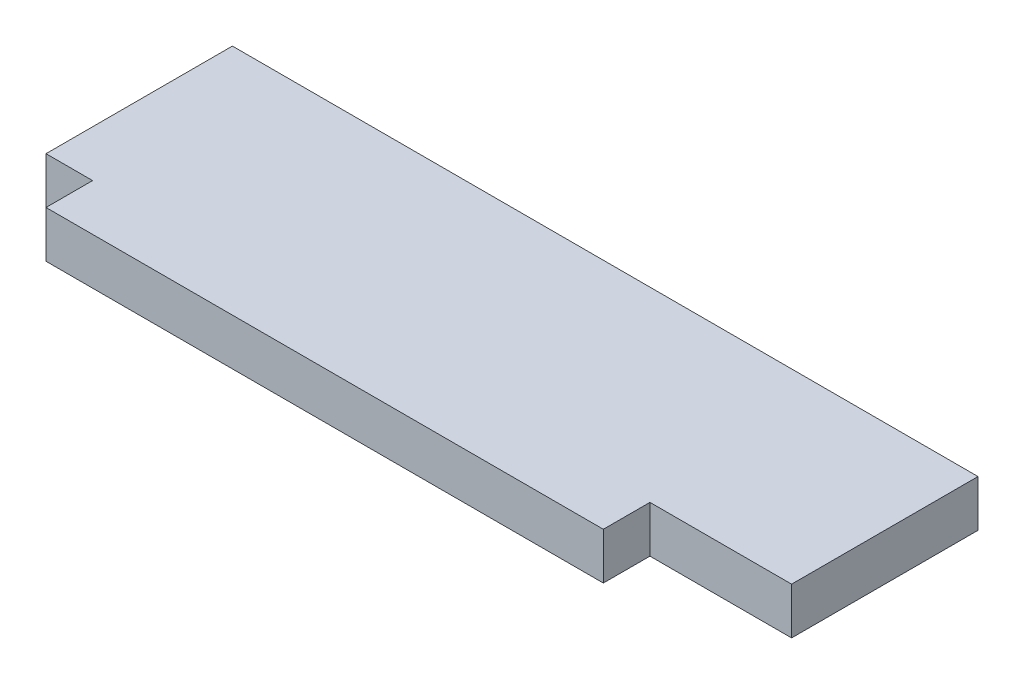
from build123d import *

# Parameters (mm, degrees)
BOSS_EXTRUDE1_DEPTH = 5


with BuildPart() as part:
    # Sketch1 → Boss-Extrude1 (new body)
    with BuildSketch(Plane(origin=(0, 0, 0), x_dir=(1, 0, 0), z_dir=(0, 1, 0))):
        Polygon((0, 20), (0, 0), (5, 0), (5, -5), (64.8, -5), (64.8, 0), (80, 0), (80, 20), align=None)
    extrude(amount=BOSS_EXTRUDE1_DEPTH)


solid = part.part
